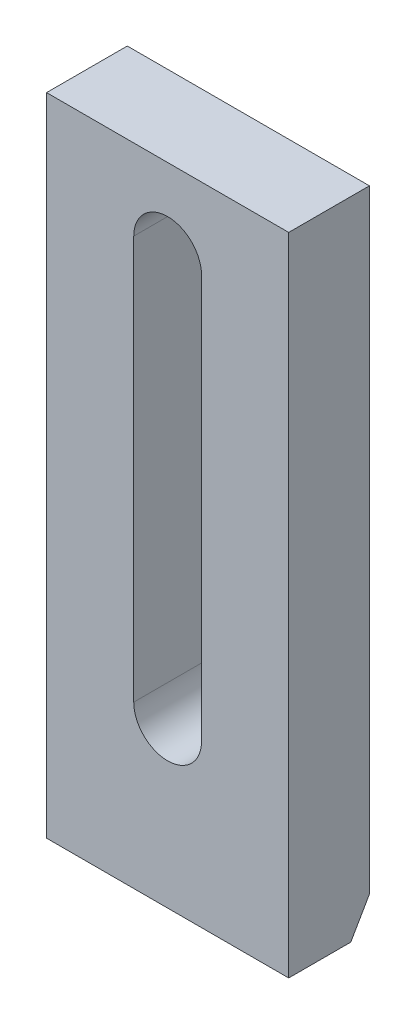
from build123d import *

# Parameters (mm, degrees)
SKETCH_1_W          = 75
SKETCH_1_H          = 200
EXTRUDE_1_DEPTH     = 25
CUT_EXTRUDE_1_DEPTH = 216.058131676
CHAMFER_1_SIZE      = 10
CHAMFER_1_SIZE2     = 5.773502692


with BuildPart() as part:
    # Эскиз1 → Бобышка-Вытянуть1 (new body)
    with BuildSketch(Plane.XY):
        with Locations((37.5, 100)):
            Rectangle(SKETCH_1_W, SKETCH_1_H)
    extrude(amount=EXTRUDE_1_DEPTH)

    # Эскиз2 → Вырез-Вытянуть1 (cut, through all)
    with BuildSketch(Plane.XY.offset(25)):
        with BuildLine():
            Line((27, 50), (27, 175))
            ThreePointArc((27, 175), (37.5, 185.5), (48, 175))
            Line((48, 175), (48, 50))
            ThreePointArc((48, 50), (37.5, 39.5), (27, 50))
        make_face()
    extrude(amount=-CUT_EXTRUDE_1_DEPTH, mode=Mode.SUBTRACT)

    # Фаска1
    chamfer_1_edges = [part.edges().sort_by_distance(p)[0] for p in [
        (37.5, 0, 0),
    ]]
    chamfer_1_side = [part.faces().sort_by_distance(p)[0] for p in [
        (37.5, 2.136000936, 0),
    ]]
    chamfer(chamfer_1_edges, length=CHAMFER_1_SIZE, length2=CHAMFER_1_SIZE2, reference=chamfer_1_side[0])


solid = part.part
